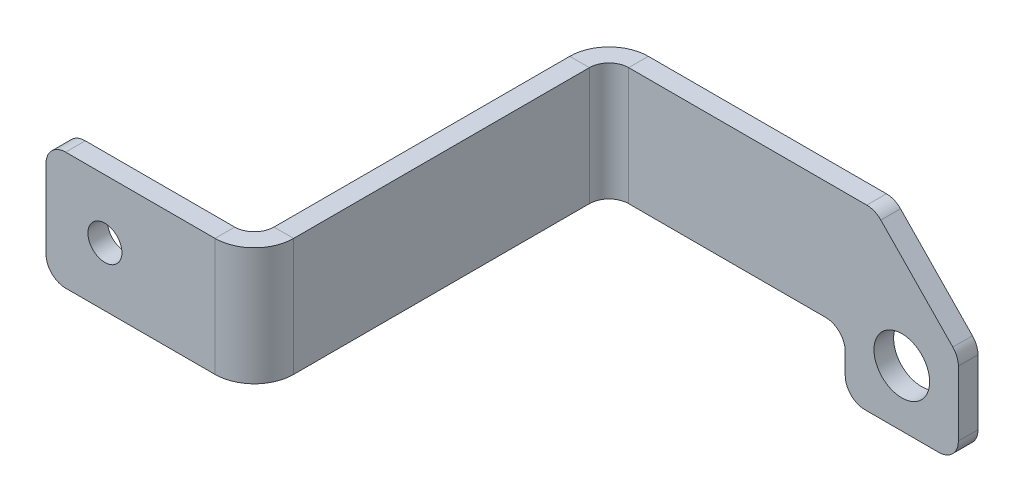
from build123d import *

# Parameters (mm, degrees)
SKETCH2_W                    = 33.6804
SKETCH2_H                    = 19.05
SKETCH2_R                    = 1.189975692
BASE_FLANGE1_DEPTH           = 3.175
EDGE_FLANGE3_STRIP_W         = 19.05
EDGE_FLANGE3_STRIP_H         = 3.175
EDGE_FLANGE3_STRIP_CUT_DEPTH = 19.05
EDGE_FLANGE3_DEPTH           = 19.05
M5_CLEARANCE_HOLE1_D         = 5.5
EDGE_FLANGE5_STRIP_W         = 19.05
EDGE_FLANGE5_STRIP_H         = 3.175
EDGE_FLANGE5_STRIP_CUT_DEPTH = 19.05
EDGE_FLANGE5_DEPTH           = 19.05
EDGE_FLANGE5_START           = 3.175
EDGE_FLANGE5_PROFILE_R       = 1.708184841
EDGE_FLANGE5_FLAT_DEPTH      = 3.175
M8_CLEARANCE_HOLE1_D         = 9
FILLET2_R                    = 3.175


# Sheet-metal steps are written as plain solids
with BuildPart() as part:
    # Sketch2 → Base-Flange1 (new body)
    with BuildSketch(Plane.XY):
        with Locations((7.3152, 0)):
            Rectangle(SKETCH2_W, SKETCH2_H)
        Circle(SKETCH2_R, mode=Mode.SUBTRACT)
    extrude(amount=-BASE_FLANGE1_DEPTH)

    # Edge-Flange3 strip (across the edge) → Edge-Flange3 strip cut (cut)
    with BuildSketch(Plane(origin=(24.1554, 9.525, -3.175), x_dir=(-1, 0, 0), z_dir=(0, -1, 0))):
        with Locations((-3.175, -1.5875)):
            Rectangle(EDGE_FLANGE3_STRIP_W, EDGE_FLANGE3_STRIP_H)
    extrude(amount=EDGE_FLANGE3_STRIP_CUT_DEPTH, mode=Mode.SUBTRACT)

    # Edge-Flange3 section (across the edge) → Edge-Flange3 (add)
    with BuildSketch(Plane(origin=(24.1554, 9.525, -3.175), x_dir=(-1, 0, 0), z_dir=(0, -1, 0))):
        with BuildLine():
            Line((0, 3.175), (0, 54.16804))
            Line((0, 54.16804), (3.175, 54.16804))
            Line((3.175, 54.16804), (3.175, 3.175))
            ThreePointArc((3.175, 3.175), (4.10493597, 0.92993597), (6.35, 0))
            Line((6.35, 0), (6.35, -3.175))
            ThreePointArc((6.35, -3.175), (1.859871939, -1.315128061), (0, 3.175))
        make_face()
    extrude(amount=EDGE_FLANGE3_DEPTH)

    # M5 Clearance Hole1 (through all)
    with Locations(Plane.XY):
        with Locations((0, 0)):
            Hole(M5_CLEARANCE_HOLE1_D / 2)

    # Edge-Flange5 strip (across the edge) → Edge-Flange5 strip cut (cut)
    with BuildSketch(Plane(origin=(24.1554, -9.525, -57.34304), x_dir=(0, 0, 1), z_dir=(0, 1, 0))):
        with Locations((-6.35, -1.5875)):
            Rectangle(EDGE_FLANGE5_STRIP_W, EDGE_FLANGE5_STRIP_H)
    extrude(amount=EDGE_FLANGE5_STRIP_CUT_DEPTH, mode=Mode.SUBTRACT)

    # Edge-Flange5 bend section (across the edge) → Edge-Flange5 (add)
    with BuildSketch(Plane(origin=(24.1554, -9.525, -57.34304), x_dir=(0, 0, 1), z_dir=(0, 1, 0))):
        with BuildLine():
            Line((-3.175, 3.175), (0, 3.175))
            ThreePointArc((0, 3.175), (0.92993597, 0.92993597), (3.175, 0))
            Line((3.175, 0), (3.175, -3.175))
            ThreePointArc((3.175, -3.175), (-1.315128061, -1.315128061), (-3.175, 3.175))
        make_face()
    extrude(amount=EDGE_FLANGE5_DEPTH)

    # Edge-Flange5 profile (on flange) → Edge-Flange5 flat (add)
    with BuildSketch(Plane(origin=(24.1554, 0, -57.34304), x_dir=(0, 1, 0), z_dir=(0, 0, -1)).offset(EDGE_FLANGE5_START)):
        Polygon((-9.525, 3.175), (9.525, 3.175), (9.525, 43.014170651), (-4.326239915, 56.477027), (-19.2786, 56.477027), (-19.2786, 38.189027), (-9.525, 38.189027), align=None)
        with Locations((-10.1346, 47.333027)):
            Circle(EDGE_FLANGE5_PROFILE_R, mode=Mode.SUBTRACT)
    extrude(amount=-EDGE_FLANGE5_FLAT_DEPTH)

    # M8 Clearance Hole1 (through all)
    with Locations(Plane(origin=(0, 0, -60.51804), x_dir=(-1, 0, 0), z_dir=(0, 0, -1))):
        with Locations((-71.488427, -10.1346)):
            Hole(M8_CLEARANCE_HOLE1_D / 2)

    # Fillet2
    fillet2_edges = [part.edges().sort_by_distance(p)[0] for p in [
        (-9.525, 9.525, -1.5875),
        (62.344427, -9.525, -58.93054),
        (67.169570651, 9.525, -58.93054),
        (-9.525, -9.525, -1.5875),
        (80.632427, -4.326239915, -58.93054),
        (80.632427, -19.2786, -58.93054),
        (62.344427, -19.2786, -58.93054),
    ]]
    fillet(fillet2_edges, radius=FILLET2_R)


solid = part.part
